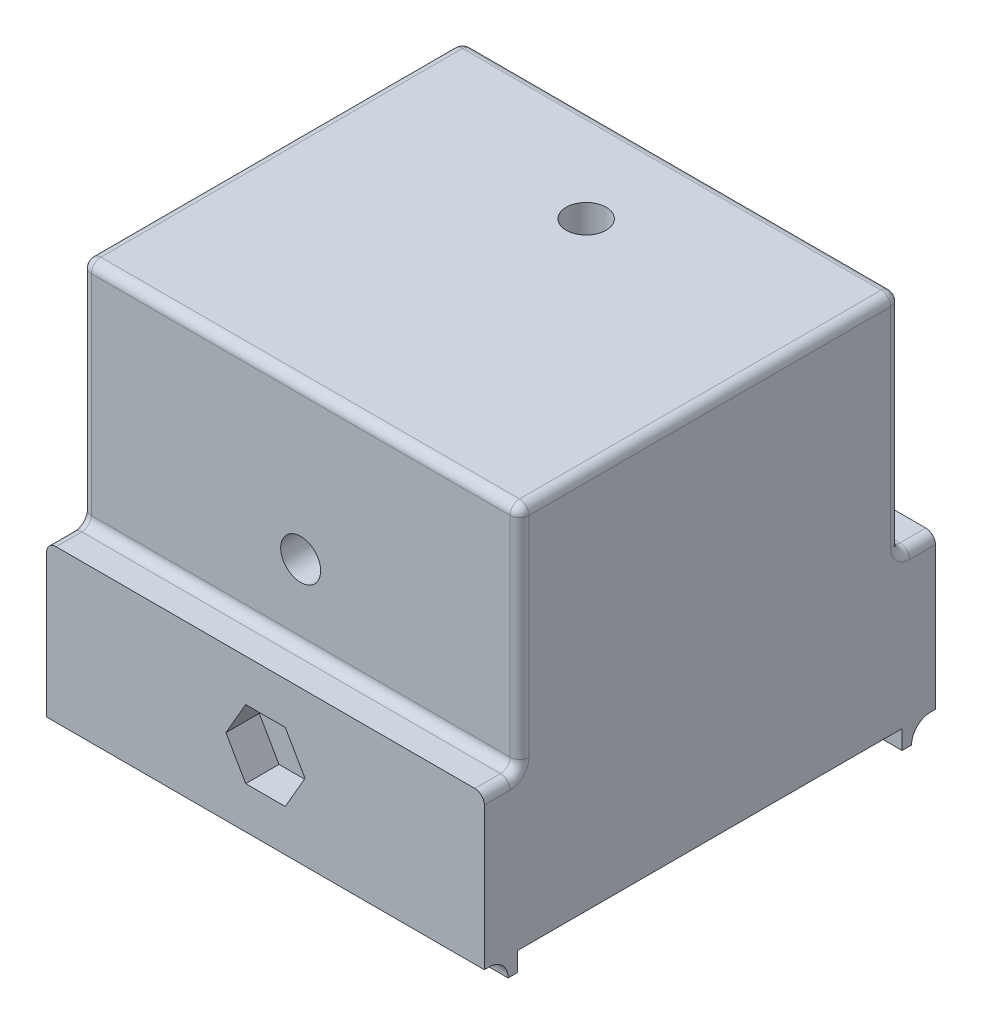
from build123d import *

# Parameters (mm, degrees)
SKETCH1_W           = 46
SKETCH1_H           = 40
BOSS_EXTRUDE1_DEPTH = 40
SKETCH2_W           = 46
SKETCH2_H           = 3.7
BOSS_EXTRUDE2_DEPTH = 16
SKETCH5_W           = 40
SKETCH5_H           = 34
CUT_EXTRUDE3_DEPTH  = 37
FILLET1_R           = 1
FILLET2_R           = 1
CUT_EXTRUDE6_DEPTH  = 3.5
SKETCH9_W           = 46
SKETCH9_H           = 1
BOSS_EXTRUDE3_DEPTH = 2
CUT_EXTRUDE7_REACH  = 65.551
SKETCH12_R          = 2.1
CUT_EXTRUDE8_REACH  = 55.429
SKETCH13_R          = 2.1
FILLET3_R           = 2


with BuildPart() as part:
    # Sketch1 → Boss-Extrude1 (new body)
    with BuildSketch(Plane(origin=(0, 0, 0), x_dir=(1, 0, 0), z_dir=(0, 1, 0))):
        Rectangle(SKETCH1_W, SKETCH1_H)
    extrude(amount=BOSS_EXTRUDE1_DEPTH)

    # Sketch2 → Boss-Extrude2 (add)
    with BuildSketch(Plane.XZ):
        with Locations((0, 21.85)):
            Rectangle(SKETCH2_W, SKETCH2_H)
        with Locations((0, -21.85)):
            Rectangle(SKETCH2_W, SKETCH2_H)
    extrude(amount=-BOSS_EXTRUDE2_DEPTH)

    # Sketch5 → Cut-Extrude3 (cut)
    with BuildSketch(Plane.XZ):
        Rectangle(SKETCH5_W, SKETCH5_H)
    extrude(amount=-CUT_EXTRUDE3_DEPTH, mode=Mode.SUBTRACT)

    # Fillet1
    fillet1_edges = [part.edges().sort_by_distance(p)[0] for p in [
        (23, 40, 0),
        (0, 40, -20),
        (-23, 16, 21.85),
        (23, 16, 21.85),
        (0, 16, 20),
        (-23, 16, -21.85),
        (0, 16, -20),
        (23, 16, -21.85),
        (-23, 40, 0),
        (0, 40, 20),
        (-23, 28, -20),
        (23, 28, -20),
        (23, 28, 20),
        (-23, 28, 20),
    ]]
    fillet(fillet1_edges, radius=FILLET1_R)

    # Fillet2
    fillet2_edges = [part.edges().sort_by_distance(p)[0] for p in [
        (-20, 37, 0),
        (-20, 18.5, -17),
        (0, 37, 17),
        (-20, 18.5, 17),
        (20, 37, 0),
        (20, 18.5, 17),
        (0, 37, -17),
        (20, 18.5, -17),
    ]]
    fillet(fillet2_edges, radius=FILLET2_R)

    # Sketch3 → Cut-Extrude6 (cut)
    with BuildSketch(Plane(origin=(0, 0, -23.7), x_dir=(-1, 0, 0), z_dir=(0, 0, -1))):
        Polygon((2.078460969, 11.6), (-2.078460969, 11.6), (-4.156921938, 8), (-2.078460969, 4.4), (2.078460969, 4.4), (4.156921938, 8), align=None)
    cut_extrude6 = extrude(amount=-CUT_EXTRUDE6_DEPTH, mode=Mode.SUBTRACT)

    # Mirror2: Cut-Extrude6 across plane
    add(cut_extrude6.mirror(Plane.XY), mode=Mode.SUBTRACT)

    # Sketch9 → Boss-Extrude3 (add)
    with BuildSketch(Plane.XZ):
        with Locations((0, 20.7)):
            Rectangle(SKETCH9_W, SKETCH9_H)
        with Locations((0, -20.7)):
            Rectangle(SKETCH9_W, SKETCH9_H)
    extrude(amount=BOSS_EXTRUDE3_DEPTH)

    # Sketch12 → Cut-Extrude7 (cut, up to next)
    with BuildSketch(Plane.XY.offset(20), mode=Mode.PRIVATE) as cut_extrude7_sk1:
        with Locations((0, 24)):
            Circle(SKETCH12_R)
    cut_extrude7_tool1 = extrude(cut_extrude7_sk1.sketch, amount=-CUT_EXTRUDE7_REACH, mode=Mode.PRIVATE) & part.part
    add(cut_extrude7_tool1.solids().sort_by_distance((0, 24, 20))[0], mode=Mode.SUBTRACT)

    # Sketch13 → Cut-Extrude8 (cut, up to next)
    with BuildSketch(Plane(origin=(0, 40, 0), x_dir=(1, 0, 0), z_dir=(0, 1, 0)), mode=Mode.PRIVATE) as cut_extrude8_sk1:
        with Locations(Location((0, 10, 0), (0, 0, 270))):
            Circle(SKETCH13_R)
    cut_extrude8_tool1 = extrude(cut_extrude8_sk1.sketch, amount=-CUT_EXTRUDE8_REACH, mode=Mode.PRIVATE) & part.part
    add(cut_extrude8_tool1.solids().sort_by_distance((0, 40, -10))[0], mode=Mode.SUBTRACT)

    # Fillet3
    fillet3_edges = [part.edges().sort_by_distance(p)[0] for p in [
        (0, 0, 21.2),
        (0, 0, -21.2),
    ]]
    fillet(fillet3_edges, radius=FILLET3_R - 0.0001)  # a hair under: the kernel refuses the full size


solid = part.part
